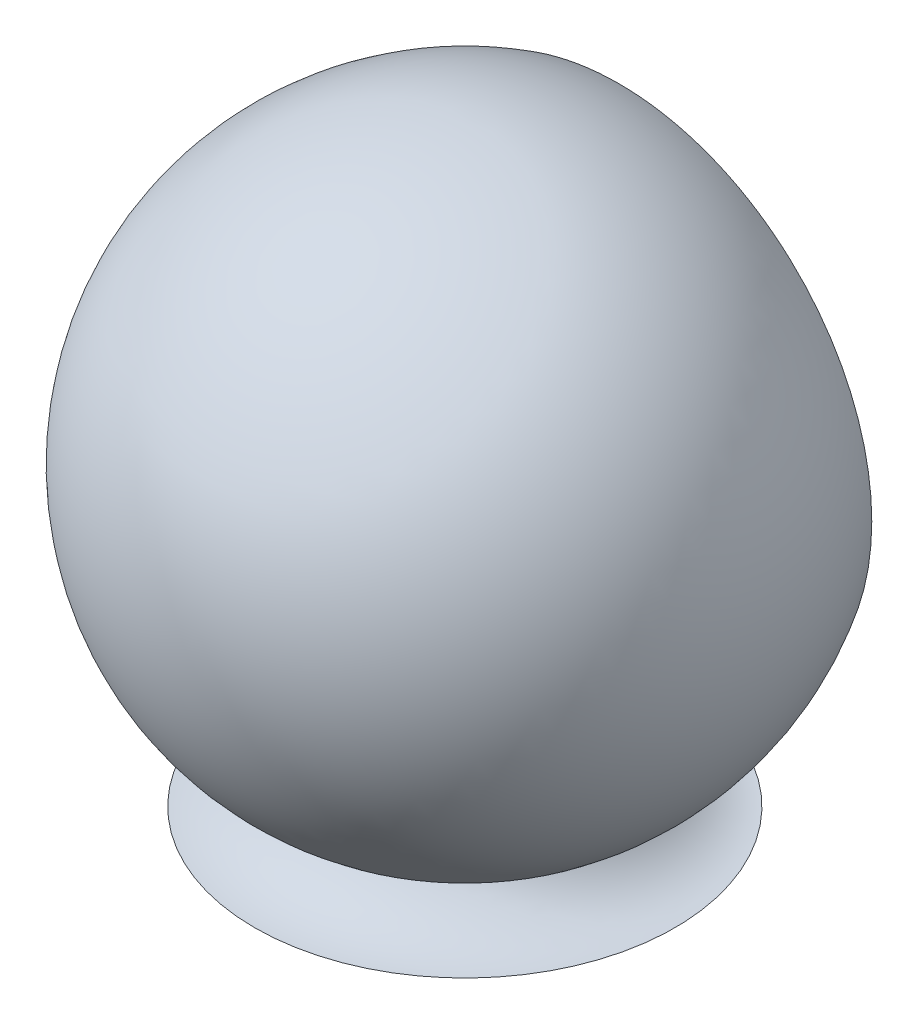
from build123d import *

# Parameters (mm, degrees)
SKETCH_3_R           = 87.121396443
CUT_EXTRUDE_1_DEPTH  = 138
SKETCH_5_R           = 79.812746669
SKETCH_5_R_2         = 74.840103916
EXTRUDE_1_DEPTH      = 49.5
EXTRUDE_3_DEPTH      = 65
EXTRUDE_4_DEPTH      = 2
EXTRUDE_5_DEPTH      = 3
SKETCH_10_W          = 38.697479312
SKETCH_10_H          = 7.772746412
CUT_EXTRUDE_2_DEPTH  = 2
FILLET_1_R           = 1
EXTRUDE_6_DEPTH      = 78
SKETCH_14_R          = 1.5
EXTRUDE_7_DEPTH      = 1.5
EXTRUDE_8_DEPTH      = 31.5
SKETCH_16_W          = 0.838273508
SKETCH_16_H          = 63
EXTRUDE_9_DEPTH      = 1
SKETCH_17_W          = 63
SKETCH_17_H          = 1
EXTRUDE_10_DEPTH     = 16
SKETCH_18_W          = 1.47283298
SKETCH_18_H          = 2.025145348
SKETCH_18_H_2        = 1.656937102
SKETCH_18_H_3        = 1.288728857
SKETCH_18_H_4        = 1.104624735
SKETCH_18_W_2        = 1.708041247
SKETCH_18_H_5        = 2.20924947
SKETCH_18_H_6        = 1.551368846
SKETCH_18_H_7        = 47.332014683
SKETCH_18_H_8        = 1.561146029
SKETCH_18_H_9        = 1.656937103
CUT_EXTRUDE_4_DEPTH  = 3
SKETCH_19_W          = 58.287502907
SKETCH_19_H          = 1.893146119
SKETCH_19_H_2        = 1.709965009
SKETCH_19_H_3        = 2.628459885
SKETCH_19_H_4        = 2.230389142
SKETCH_19_H_5        = 1.701903361
CUT_EXTRUDE_6_DEPTH  = 29
SKETCH_20_R          = 1.5
EXTRUDE_11_DEPTH     = 53.948968505
EXTRUDE_12_DEPTH     = 4
CUT_EXTRUDE_7_DEPTH  = 65
EXTRUDE_15_DEPTH     = 4
SKETCH_29_R          = 79.812746669
CUT_EXTRUDE_11_DEPTH = 31
EXTRUDE_19_DEPTH     = 27
EXTRUDE_21_DEPTH     = 1
CUT_EXTRUDE_13_DEPTH = 25
SKETCH_33_W          = 19.69553283
SKETCH_33_H          = 22.978121635
CUT_EXTRUDE_14_DEPTH = 3
EXTRUDE_23_DEPTH     = 1
SKETCH_37_R          = 2
CUT_EXTRUDE_15_DEPTH = 74
SKETCH_38_R          = 1.5
CUT_EXTRUDE_16_DEPTH = 56.948968505
EXTRUDE_25_DEPTH     = 1
SKETCH_40_R          = 3.5
EXTRUDE_26_DEPTH     = 3
SKETCH_42_R          = 0.536225654
EXTRUDE_27_DEPTH     = 55
SKETCH_43_R          = 1.466734261
EXTRUDE_28_DEPTH     = 4


with BuildPart() as part:
    # 草图1 → 旋转1 (revolve)
    with BuildSketch(Plane.XY):
        with BuildLine():
            Line((0, -102.07583938), (0, 102.07583938))
            ThreePointArc((0, 102.07583938), (102.07583938, 0), (0, -102.07583938))
        make_face()
    revolve(axis=Axis((0, -102.07583938, 0), (0, 1, 0)))

    # 草图2 → 切除-旋转1 (revolve, cut)
    with BuildSketch(Plane.XY):
        with BuildLine():
            Line((0, -95.499061341), (0, 95.499061341))
            ThreePointArc((0, 95.499061341), (95.499061341, 0), (0, -95.499061341))
        make_face()
    revolve(axis=Axis((0, -95.499061341, 0), (0, 1, 0)), mode=Mode.SUBTRACT)

    # 草图3 → 切除-拉伸1 (cut)
    with BuildSketch(Plane.XY):
        Circle(SKETCH_3_R)
    extrude(amount=-CUT_EXTRUDE_1_DEPTH, mode=Mode.SUBTRACT)

    # 草图36 → 旋转16 (revolve)
    with BuildSketch(Plane.XY):
        with BuildLine():
            Line((-72.440207076, -102.07583938), (0, -102.07583938))
            ThreePointArc((0, -102.07583938), (-24.829356935, -99.009999593), (-48.167218313, -89.996644744))
            ThreePointArc((-48.167218313, -89.996644744), (-58.883982246, -98.889172432), (-72.440207076, -102.07583938))
        make_face()
        with BuildLine():
            ThreePointArc((-48.167218313, -89.996644744), (-24.829356935, -99.009999593), (0, -102.07583938))
            Line((0, -102.07583938), (0, -97.823615905))
            Line((0, -97.823615905), (-48.167218313, -89.996644744))
        make_face()
    revolve(axis=Axis((0, -102.07583938, 0), (0, 1, 0)))


with BuildPart() as body_2:
    # 草图5 → 凸台-拉伸1 (new, symmetric)
    with BuildSketch(Plane.XY):
        Circle(SKETCH_5_R)
        Circle(SKETCH_5_R_2, mode=Mode.SUBTRACT)
    extrude(amount=EXTRUDE_1_DEPTH, both=True)

    # 草图12 → 凸台-拉伸6 (add)
    with BuildSketch(Plane(origin=(0, 0, 0), x_dir=(1, 0, 0), z_dir=(0, 1, 0))):
        with BuildLine():
            ThreePointArc((1.539586673, 18), (0.039586673, 19.5), (-1.460413327, 18))
            Line((-1.460413327, 18), (1.539586673, 18))
        make_face()
        with BuildLine():
            Line((1.539586673, 18), (-1.460413327, 18))
            ThreePointArc((-1.460413327, 18), (0.039586673, 16.5), (1.539586673, 18))
        make_face()
    extrude(amount=EXTRUDE_6_DEPTH)

    # 草图14 → 凸台-拉伸7 (add, symmetric)
    with BuildSketch(Plane(origin=(0, 0, 0), x_dir=(0, 0, -1), z_dir=(1, 0, 0))):
        with Locations((18, 0)):
            Circle(SKETCH_14_R)
    extrude(amount=EXTRUDE_7_DEPTH, both=True)



with BuildPart() as body_3:
    # 草图7 → 凸台-拉伸3 (new body)
    with BuildSketch(Plane(origin=(0, 0, -49.5), x_dir=(-1, 0, 0), z_dir=(0, 0, -1))):
        with BuildLine():
            Line((-59.007425143, -37.164815191), (-62.001789246, -37.164815191))
            ThreePointArc((-62.001789246, -37.164815191), (0, -72.287242013), (62.001789246, -37.164815191))
            Line((62.001789246, -37.164815191), (59.007425143, -37.164815191))
            ThreePointArc((59.007425143, -37.164815191), (0, -69.735928403), (-59.007425143, -37.164815191))
        make_face()
    extrude(amount=-EXTRUDE_3_DEPTH)

    # 草图8 → 凸台-拉伸4 (add)
    with BuildSketch(Plane.XY.offset(15.5)):
        with BuildLine():
            Line((-59.007425143, -37.164815191), (59.007425143, -37.164815191))
            ThreePointArc((59.007425143, -37.164815191), (0, -69.735928403), (-59.007425143, -37.164815191))
        make_face()
    extrude(amount=-EXTRUDE_4_DEPTH)

    # 草图9 → 凸台-拉伸5 (add)
    with BuildSketch(Plane(origin=(0, 0, -49.5), x_dir=(-1, 0, 0), z_dir=(0, 0, -1))):
        with BuildLine():
            Line((-62.001789246, -37.164815191), (62.001789246, -37.164815191))
            ThreePointArc((62.001789246, -37.164815191), (0, -72.287242013), (-62.001789246, -37.164815191))
        make_face()
    extrude(amount=EXTRUDE_5_DEPTH)

    # 草图10 → 切除-拉伸2 (cut)
    with BuildSketch(Plane(origin=(0, 0, -52.5), x_dir=(-1, 0, 0), z_dir=(0, 0, -1))):
        with Locations((0, -47.523840825)):
            Rectangle(SKETCH_10_W, SKETCH_10_H)
    extrude(amount=-CUT_EXTRUDE_2_DEPTH, mode=Mode.SUBTRACT)

    # 圆角1
    fillet_1_edges = [body_3.edges().sort_by_distance(p)[0] for p in [
        (0, -51.410214031, -52.5),
        (-19.348739656, -47.523840825, -50.5),
        (19.348739656, -47.523840825, -50.5),
        (0, -43.637467619, -50.5),
        (-19.348739656, -47.523840825, -52.5),
        (19.348739656, -47.523840825, -52.5),
        (0, -43.637467619, -52.5),
    ]]
    fillet(fillet_1_edges, radius=FILLET_1_R - 0.0001)  # a hair under: the kernel refuses the full size


with BuildPart() as body_4:
    # 草图15 → 凸台-拉伸8 (new, symmetric)
    with BuildSketch(Plane.XY.offset(-18)):
        with BuildLine():
            Line((-67.098471056, -24.550973146), (-67.885702445, -24.839016917))
            ThreePointArc((-67.885702445, -24.839016917), (-71.178351905, -12.612992428), (-72.287242013, 0))
            Line((-72.287242013, 0), (-71.448968505, 0))
            ThreePointArc((-71.448968505, 0), (-70.352937556, -12.46672682), (-67.098471056, -24.550973146))
        make_face()
    extrude(amount=EXTRUDE_8_DEPTH, both=True)

    # 草图16 → 凸台-拉伸9 (add)
    with BuildSketch(Plane(origin=(0, 0, 0), x_dir=(1, 0, 0), z_dir=(0, 1, 0))):
        with Locations((-71.868105259, 18)):
            Rectangle(SKETCH_16_W, SKETCH_16_H)
    extrude(amount=EXTRUDE_9_DEPTH)

    # 草图17 → 凸台-拉伸10 (add)
    with BuildSketch(Plane(origin=(-71.448968505, 0, 0), x_dir=(0, 0, -1), z_dir=(1, 0, 0))):
        with Locations((18, 0.5)):
            Rectangle(SKETCH_17_W, SKETCH_17_H)
    extrude(amount=EXTRUDE_10_DEPTH)

    # 草图18 → 切除-拉伸4 (cut)
    with BuildSketch(Plane(origin=(0, 1, 0), x_dir=(1, 0, 0), z_dir=(0, 1, 0))):
        Polygon((-68.842752761, -11.048711658), (-68.842752761, 46.02356631), (-68.842752761, 48.048711658), (-70.499689863, 48.048711658), (-70.499689863, -12.337440515), (-68.842752761, -12.337440515), align=None)
        Polygon((-58.34881778, 48.048711658), (-58.34881778, 46.02356631), (-58.34881778, -11.048711658), (-58.34881778, -12.337440515), (-57.060088922, -12.337440515), (-57.060088922, 48.048711658), align=None)
        with Locations((-66.449399169, 47.036138984)):
            Rectangle(SKETCH_18_W, SKETCH_18_H)
        Polygon((-65.712982679, 44.366629208), (-67.185815659, 44.366629208), (-67.185815659, -9.944086923), (-65.712982679, -9.944086923), (-65.712982679, -8.28714982), (-65.712982679, 42.157379738), align=None)
        with Locations((-66.449399169, 45.195097759)):
            Rectangle(SKETCH_18_W, SKETCH_18_H_2)
        with Locations((-66.449399169, -11.693076086)):
            Rectangle(SKETCH_18_W, SKETCH_18_H_3)
        with Locations((-66.449399169, -10.496399291)):
            Rectangle(SKETCH_18_W, SKETCH_18_H_4)
        with Locations((-60.742171372, -10.496399291)):
            Rectangle(SKETCH_18_W, SKETCH_18_H_4)
        with Locations((-60.742171372, -11.693076086)):
            Rectangle(SKETCH_18_W, SKETCH_18_H_3)
        Polygon((-60.005754882, 44.366629208), (-61.478587862, 44.366629208), (-61.478587862, 42.157379738), (-61.478587862, -8.28714982), (-61.478587862, -9.944086923), (-60.005754882, -9.944086923), align=None)
        with Locations((-60.742171372, 45.195097759)):
            Rectangle(SKETCH_18_W, SKETCH_18_H_2)
        with Locations((-60.742171372, 47.036138984)):
            Rectangle(SKETCH_18_W, SKETCH_18_H)
        with Locations((-63.600665683, 47.036138984)):
            Rectangle(SKETCH_18_W_2, SKETCH_18_H)
        with Locations((-63.600665683, 45.195097759)):
            Rectangle(SKETCH_18_W_2, SKETCH_18_H_2)
        with Locations((-63.600665683, 43.262004473)):
            Rectangle(SKETCH_18_W_2, SKETCH_18_H_5)
        with Locations((-63.600665683, 41.381695315)):
            Rectangle(SKETCH_18_W_2, SKETCH_18_H_6)
        with Locations((-63.600665683, 16.940003551)):
            Rectangle(SKETCH_18_W_2, SKETCH_18_H_7)
        with Locations((-63.600665683, -7.506576805)):
            Rectangle(SKETCH_18_W_2, SKETCH_18_H_8)
        with Locations((-63.600665683, -9.115618372)):
            Rectangle(SKETCH_18_W_2, SKETCH_18_H_9)
        with Locations((-63.600665683, -10.496399291)):
            Rectangle(SKETCH_18_W_2, SKETCH_18_H_4)
        with Locations((-63.600665683, -11.693076086)):
            Rectangle(SKETCH_18_W_2, SKETCH_18_H_3)
    extrude(amount=-CUT_EXTRUDE_4_DEPTH, mode=Mode.SUBTRACT)

    # 草图19 → 切除-拉伸6 (cut)
    with BuildSketch(Plane(origin=(-55.448968505, 0, 0), x_dir=(0, 0, -1), z_dir=(1, 0, 0))):
        with Locations((17.899707097, -21.902496725)):
            Rectangle(SKETCH_19_W, SKETCH_19_H)
        with Locations((17.899707097, -17.870552018)):
            Rectangle(SKETCH_19_W, SKETCH_19_H_2)
        with Locations((17.899707097, -13.991374564)):
            Rectangle(SKETCH_19_W, SKETCH_19_H_3)
        with Locations((17.899707097, -9.193702232)):
            Rectangle(SKETCH_19_W, SKETCH_19_H_2)
        with Locations((17.899707097, -5.513560148)):
            Rectangle(SKETCH_19_W, SKETCH_19_H_4)
        with Locations((17.899707097, -1.654267777)):
            Rectangle(SKETCH_19_W, SKETCH_19_H_5)
    extrude(amount=-CUT_EXTRUDE_6_DEPTH, mode=Mode.SUBTRACT)


with BuildPart() as body_2_1:
    add(body_2.part)

    add(body_4.part)  # 凸台-拉伸11 merges body 4
    # 草图20 → 凸台-拉伸11 (add)
    with BuildSketch(Plane.ZY.offset(1.5)):
        with Locations((-18, 0)):
            Circle(SKETCH_20_R)
    extrude(amount=EXTRUDE_11_DEPTH)

    # 草图23 → 切除-拉伸7 (cut)
    with BuildSketch(Plane(origin=(0, 0, -49.5), x_dir=(-1, 0, 0), z_dir=(0, 0, -1))):
        with BuildLine():
            ThreePointArc((-74.840103916, 0), (-73.77193168, 12.599335309), (-70.597906433, 24.839016917))
            Line((-70.597906433, 24.839016917), (-72.648999251, 24.839016917))
            ThreePointArc((-72.648999251, 24.839016917), (-75.738679691, 12.589926618), (-76.777951611, 0))
            Line((-76.777951611, 0), (-74.840103916, 0))
        make_face()
    extrude(amount=-CUT_EXTRUDE_7_DEPTH, mode=Mode.SUBTRACT)



with BuildPart() as body_4_2:
    # 草图21 → 凸台-拉伸12 (new body)
    with BuildSketch(Plane(origin=(0, 0, -49.5), x_dir=(-1, 0, 0), z_dir=(0, 0, -1))):
        with BuildLine():
            Line((-55.448968505, 0), (-72.287242013, 0))
            ThreePointArc((-72.287242013, 0), (-71.178351905, 12.612992428), (-67.885702445, 24.839016917))
            Line((-67.885702445, 24.839016917), (-49.574301274, 24.839016917))
            ThreePointArc((-49.574301274, 24.839016917), (-53.960318653, 12.762136151), (-55.448968505, 0))
        make_face()
    extrude(amount=-EXTRUDE_12_DEPTH)


with BuildPart() as body_2_2:
    add(body_2_1.part)

    add(body_4_2.part)  # 凸台-拉伸15 merges body 4 2
    # 草图24 → 凸台-拉伸15 (add)
    with BuildSketch(Plane(origin=(0, 0, -49.5), x_dir=(-1, 0, 0), z_dir=(0, 0, -1))):
        with BuildLine():
            Line((-74.853136149, 12.393450937), (-71.216906221, 12.393450937))
            ThreePointArc((-71.216906221, 12.393450937), (-71.275102061, 12.054259994), (-71.331682417, 11.714795836))
            Line((-71.331682417, 11.714795836), (-74.962345054, 11.714795836))
            Line((-74.962345054, 11.714795836), (-75.878965545, 11.714795836))
            ThreePointArc((-75.878965545, 11.714795836), (-75.825780926, 12.054244089), (-75.771077777, 12.393450937))
            Line((-75.771077777, 12.393450937), (-74.853136149, 12.393450937))
        make_face()
    extrude(amount=-EXTRUDE_15_DEPTH)

    # 草图29 → 切除-拉伸11 (cut)
    with BuildSketch(Plane.XY.offset(18.5)):
        Circle(SKETCH_29_R)
    extrude(amount=CUT_EXTRUDE_11_DEPTH, mode=Mode.SUBTRACT)

    # 草图30 → 凸台-拉伸19 (add)
    with BuildSketch(Plane.XY.offset(18.5)):
        with BuildLine():
            Line((50.303214713, 0), (74.749361553, 0))
            Line((74.749361553, 0), (74.749361553, -5.651732441))
            ThreePointArc((74.749361553, -5.651732441), (67.32542677, -32.965073068), (50.303214713, -55.578734438))
            Line((50.303214713, -55.578734438), (50.303214713, 0))
        make_face()
    extrude(amount=EXTRUDE_19_DEPTH)

    # 草图32 → 凸台-拉伸21 (add)
    with BuildSketch(Plane.XY.offset(45.5)):
        with BuildLine():
            Line((50.303214713, -55.578734438), (50.303214713, 0))
            Line((50.303214713, 0), (74.962718281, 0))
            ThreePointArc((74.962718281, 0), (68.521072836, -30.401837272), (50.303214713, -55.578734438))
        make_face()
    extrude(amount=EXTRUDE_21_DEPTH)

    # 草图34 → 切除-拉伸13 (cut)
    with BuildSketch(Plane.XY.offset(46.5)):
        with BuildLine():
            Line((73.277377352, -2.079557953), (51.894499712, -2.079557953))
            Line((51.894499712, -2.079557953), (51.894499712, -51.777017031))
            ThreePointArc((51.894499712, -51.777017031), (67.338392182, -28.973082875), (73.277377352, -2.079557953))
        make_face()
    extrude(amount=-CUT_EXTRUDE_13_DEPTH, mode=Mode.SUBTRACT)

    # 草图33 → 切除-拉伸14 (cut)
    with BuildSketch(Plane(origin=(0, 0, 0), x_dir=(1, 0, 0), z_dir=(0, 1, 0))):
        with Locations((62.806865802, -32.670798348)):
            Rectangle(SKETCH_33_W, SKETCH_33_H)
    extrude(amount=-CUT_EXTRUDE_14_DEPTH, mode=Mode.SUBTRACT)

    # 草图35 → 凸台-拉伸23 (add)
    # profile 1 of 2: a face of its own
    with BuildSketch(Plane.XY.offset(46.5)):
        with BuildLine():
            Line((50.303214713, 0), (50.303214713, -55.543337671))
            ThreePointArc((50.303214713, -55.543337671), (68.501903347, -30.380339166), (74.936478233, 0))
            Line((74.936478233, 0), (50.303214713, 0))
        make_face()
        with BuildLine():
            Line((51.894499712, -2.079557953), (73.277377352, -2.079557953))
            ThreePointArc((73.277377352, -2.079557953), (67.338392182, -28.973082875), (51.894499712, -51.777017031))
            Line((51.894499712, -51.777017031), (51.894499712, -2.079557953))
        make_face(mode=Mode.SUBTRACT)
    # profile 2 of 2: a face of its own
    with BuildSketch(Plane.XY.offset(46.5)):
        with BuildLine():
            ThreePointArc((73.277377352, -2.079557953), (67.338392182, -28.973082875), (51.894499712, -51.777017031))
            Line((51.894499712, -51.777017031), (51.894499712, -2.079557953))
            Line((51.894499712, -2.079557953), (73.277377352, -2.079557953))
        make_face()
    extrude(amount=EXTRUDE_23_DEPTH)

    # 草图37 → 切除-拉伸15 (cut)
    with BuildSketch(Plane(origin=(0, 0, 0), x_dir=(1, 0, 0), z_dir=(0, 1, 0))):
        with Locations((0.039586673, 18)):
            Circle(SKETCH_37_R)
    extrude(amount=CUT_EXTRUDE_15_DEPTH, mode=Mode.SUBTRACT)


with BuildPart() as cut_extrude_15_piece_1:
    # of the separate pieces the step leaves, piece 1, a body of its own (cut_extrude_15_pieces)
    add(body_2_2.part.solids().sort_by_distance((55.448968505, 0, -49.5))[0])

    # 草图39 → 凸台-拉伸25 (add)
    with BuildSketch(Plane.XY.offset(18.5)):
        with BuildLine():
            ThreePointArc((2.469772397, 0), (0.011131386, -2.469747312), (-2.469672058, -0.022262546))
            Line((-2.469672058, -0.022262546), (-72.385116285, -0.652506451))
            ThreePointArc((-72.385116285, -0.652506451), (0.652506451, -72.385116285), (72.385116285, 0.652506451))
            Line((72.385116285, 0.652506451), (2.469672058, 0.022262546))
            ThreePointArc((2.469672058, 0.022262546), (2.469747312, 0.011131386), (2.469772397, 0))
        make_face()
    extrude(amount=-EXTRUDE_25_DEPTH)

    # 草图40 → 凸台-拉伸26 (add)
    with BuildSketch(Plane.XY.offset(18.5)):
        Circle(SKETCH_40_R)
    extrude(amount=-EXTRUDE_26_DEPTH)

    # 草图43 → 凸台-拉伸28 (add)
    with BuildSketch(Plane(origin=(0, 0, 15.5), x_dir=(-1, 0, 0), z_dir=(0, 0, -1))):
        with Locations(Location((0, 0, 0), (0, 0, 180))):
            Circle(SKETCH_43_R)
    extrude(amount=EXTRUDE_28_DEPTH)


with BuildPart() as cut_extrude_15_piece_2:
    # of the separate pieces the step leaves, piece 2, a body of its own (cut_extrude_15_pieces)
    add(body_2_2.part.solids().sort_by_distance((1.5, 0.618714057, -16.633547324))[0])

    # 草图38 → 切除-拉伸16 (cut)
    with BuildSketch(Plane(origin=(1.5, 0, 0), x_dir=(0, 0, -1), z_dir=(1, 0, 0))):
        with Locations((18, 0)):
            Circle(SKETCH_38_R)
    extrude(amount=-CUT_EXTRUDE_16_DEPTH, mode=Mode.SUBTRACT)

    # 草图42 → 凸台-拉伸27 (add)
    with BuildSketch(Plane(origin=(-55.448968505, 0, 0), x_dir=(0, 0, -1), z_dir=(1, 0, 0))):
        with Locations(Location((-12.952803337, 0.463645758, 0), (0, 0, 239.842390871))):
            Circle(SKETCH_42_R)
    extrude(amount=EXTRUDE_27_DEPTH)


solid = Compound([part.part, body_3.part, cut_extrude_15_piece_1.part, cut_extrude_15_piece_2.part])
